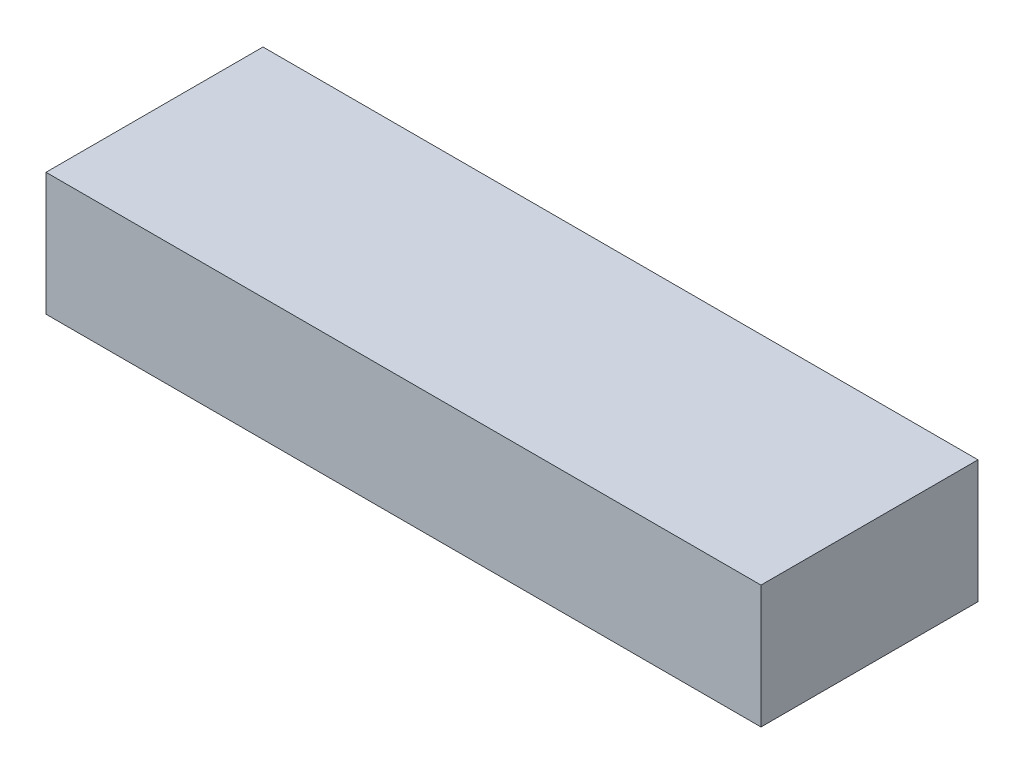
from build123d import *

# Parameters (mm, degrees)
SKETCH1_W           = 1140
SKETCH1_H           = 346
BOSS_EXTRUDE1_DEPTH = 196


with BuildPart() as part:
    # Sketch1 → Boss-Extrude1 (new body)
    with BuildSketch(Plane(origin=(0, 0, 0), x_dir=(1, 0, 0), z_dir=(0, 1, 0))):
        Rectangle(SKETCH1_W, SKETCH1_H)
    extrude(amount=BOSS_EXTRUDE1_DEPTH)


solid = part.part
